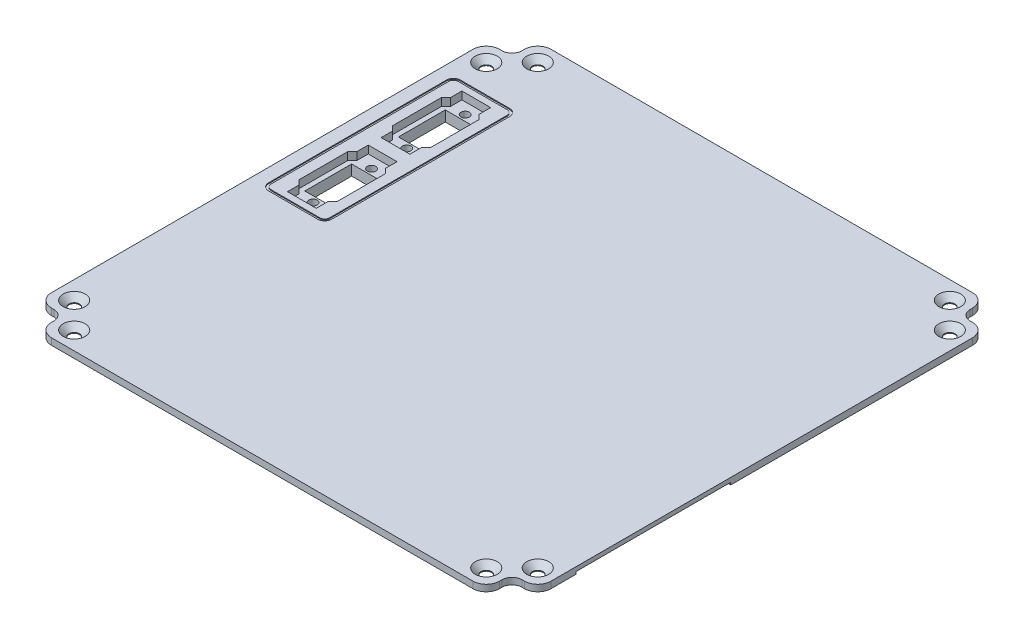
from build123d import *
from OCP.BRepFilletAPI import BRepFilletAPI_MakeChamfer, BRepFilletAPI_MakeFillet

# Parameters (mm, degrees)
SKETCH1_W                     = 214
SKETCH1_H                     = 214
BOSS_EXTRUDE1_DEPTH           = 2.8
SKETCH2_W                     = 11
SKETCH2_H                     = 11
CUT_EXTRUDE1_DEPTH            = 152.346754177
FILLET1_R1                    = 6
FILLET1_R2                    = 4
CIRPATTERN1_COUNT             = 4
FILLET1_OF_CIRPATTERN1_R1     = 6
FILLET1_OF_CIRPATTERN1_R2     = 4
FILLET1_OF_CIRPATTERN1_R3     = 6
FILLET1_OF_CIRPATTERN1_R4     = 4
FILLET1_OF_CIRPATTERN1_R5     = 6
FILLET1_OF_CIRPATTERN1_R6     = 4
CUT_EXTRUDE2_DEPTH            = 152.346754177
SKETCH7_R                     = 4.7
BOSS_EXTRUDE2_DEPTH           = 2.8
SKETCH8_W                     = 64.2
SKETCH8_H                     = 64.2
BOSS_EXTRUDE4_DEPTH           = 5
CHAMFER1_SIZE                 = 5
CHAMFER1_SIZE2                = 35
BOSS_EXTRUDE5_REACH           = 152.979
SKETCH10_W                    = 35
SKETCH10_H                    = 10.8
SKETCH10_H_2                  = 74.2
SKETCH10_H_3                  = 5
SKETCH9_W                     = 12
SKETCH9_H                     = 20
CUT_EXTRUDE3_DEPTH            = 3.3
SKETCH16_W                    = 12
SKETCH16_H                    = 20
CUT_EXTRUDE6_DEPTH            = 152.098047638
M3_CLEARANCE_HOLE1_AT_2_COUNT = 2
M3_CLEARANCE_HOLE1_AT_2_PITCH = 25
CUT_EXTRUDE_THIN1_DEPTH       = 0.4
LPATTERN1_COUNT               = 2
LPATTERN1_PITCH               = 40
SKETCH11_W                    = 4
SKETCH11_H                    = 143.4
SKETCH11_W_2                  = 143.4
SKETCH11_H_2                  = 4
SKETCH11_H_3                  = 10
CUT_EXTRUDE4_DEPTH            = 151.979402569
SKETCH12_W                    = 10.2
SKETCH12_H                    = 90
CUT_EXTRUDE5_DEPTH            = 151.979402569
CUT_EXTRUDE7_DEPTH            = 151.979402569
CUT_EXTRUDE7_DEPTH_BACK       = 1
SKETCH17_W                    = 35
SKETCH17_H                    = 66
CUT_EXTRUDE8_DEPTH            = 151.979402569
CUT_EXTRUDE8_DEPTH_BACK       = 1
SKETCH18_W                    = 35
SKETCH18_H                    = 66
SKETCH19_W                    = 8
SKETCH19_H                    = 91.967933368
SKETCH19_W_2                  = 153.383314932
SKETCH19_H_2                  = 8
SKETCH19_W_3                  = 152.504466573
CUT_EXTRUDE9_DEPTH            = 151.979402569


# Read off the part's stored shape, not the designer's step: CSK for M4 Flat Head Machine Screw1
with BuildPart() as part:
    # Sketch1 → Boss-Extrude1 (new body)
    with BuildSketch(Plane(origin=(0, 0, 0), x_dir=(1, 0, 0), z_dir=(0, 1, 0))):
        Rectangle(SKETCH1_W, SKETCH1_H)
    extrude(amount=BOSS_EXTRUDE1_DEPTH)

    # Sketch2 → Cut-Extrude1 (cut, through all)
    with BuildSketch(Plane(origin=(0, 2.8, 0), x_dir=(1, 0, 0), z_dir=(0, 1, 0))):
        with Locations((-101.5, -101.5)):
            Rectangle(SKETCH2_W, SKETCH2_H)
    cut_extrude1 = extrude(amount=-CUT_EXTRUDE1_DEPTH, mode=Mode.SUBTRACT)

    # Fillet1: one fillet with a radius per group of edges: ONE call of the kernel's fillet builder (fillet() takes one radius for all edges)
    fillet1_edges_1 = [part.edges().sort_by_distance(p)[0] for p in [
        (-107, 1.4, 96),
        (-96, 1.4, 107),
    ]]
    fillet1_edges_2 = [part.edges().sort_by_distance(p)[0] for p in [
        (-96, 1.4, 96),
    ]]
    fillet1 = BRepFilletAPI_MakeFillet(part.part.solid().wrapped)
    for e in fillet1_edges_1:
        fillet1.Add(FILLET1_R1, e.wrapped)
    for e in fillet1_edges_2:
        fillet1.Add(FILLET1_R2, e.wrapped)
    add(Compound.cast(fillet1.Shape()), mode=Mode.REPLACE)

    # CirPattern1: Cut-Extrude1 ×4 about axis
    cirpattern1_axis = Axis((0, 0, 0), (0, 1, 0))
    for i in range(1, CIRPATTERN1_COUNT):
        add(cut_extrude1.rotate(cirpattern1_axis, i * 360 / CIRPATTERN1_COUNT), mode=Mode.SUBTRACT)

    # Fillet1 of CirPattern1: one fillet with a radius per group of edges: ONE call of the kernel's fillet builder (fillet() takes one radius for all edges)
    fillet1_of_cirpattern1_edges_1 = [part.edges().sort_by_distance(p)[0] for p in [
        (96, 1.4, 107),
        (107, 1.4, 96),
    ]]
    fillet1_of_cirpattern1_edges_2 = [part.edges().sort_by_distance(p)[0] for p in [
        (96, 1.4, 96),
    ]]
    fillet1_of_cirpattern1_edges_3 = [part.edges().sort_by_distance(p)[0] for p in [
        (107, 1.4, -96),
        (96, 1.4, -107),
    ]]
    fillet1_of_cirpattern1_edges_4 = [part.edges().sort_by_distance(p)[0] for p in [
        (96, 1.4, -96),
    ]]
    fillet1_of_cirpattern1_edges_5 = [part.edges().sort_by_distance(p)[0] for p in [
        (-96, 1.4, -107),
        (-107, 1.4, -96),
    ]]
    fillet1_of_cirpattern1_edges_6 = [part.edges().sort_by_distance(p)[0] for p in [
        (-96, 1.4, -96),
    ]]
    fillet1_of_cirpattern1 = BRepFilletAPI_MakeFillet(part.part.solid().wrapped)
    for e in fillet1_of_cirpattern1_edges_1:
        fillet1_of_cirpattern1.Add(FILLET1_OF_CIRPATTERN1_R1, e.wrapped)
    for e in fillet1_of_cirpattern1_edges_2:
        fillet1_of_cirpattern1.Add(FILLET1_OF_CIRPATTERN1_R2, e.wrapped)
    for e in fillet1_of_cirpattern1_edges_3:
        fillet1_of_cirpattern1.Add(FILLET1_OF_CIRPATTERN1_R3, e.wrapped)
    for e in fillet1_of_cirpattern1_edges_4:
        fillet1_of_cirpattern1.Add(FILLET1_OF_CIRPATTERN1_R4, e.wrapped)
    for e in fillet1_of_cirpattern1_edges_5:
        fillet1_of_cirpattern1.Add(FILLET1_OF_CIRPATTERN1_R5, e.wrapped)
    for e in fillet1_of_cirpattern1_edges_6:
        fillet1_of_cirpattern1.Add(FILLET1_OF_CIRPATTERN1_R6, e.wrapped)
    add(Compound.cast(fillet1_of_cirpattern1.Shape()), mode=Mode.REPLACE)

    # Sketch3 → Cut-Extrude2 (cut, through all)
    with BuildSketch(Plane(origin=(0, 2.8, 0), x_dir=(1, 0, 0), z_dir=(0, 1, 0))):
        with BuildLine():
            Line((100, -96), (101, -96))
            ThreePointArc((101, -96), (105.242640687, -94.242640687), (107, -90))
            Line((107, -90), (107, 90))
            ThreePointArc((107, 90), (105.242640687, 94.242640687), (101, 96))
            Line((101, 96), (100, 96))
            ThreePointArc((100, 96), (97.171572875, 97.171572875), (96, 100))
            Line((96, 100), (96, 101))
            ThreePointArc((96, 101), (94.242640687, 105.242640687), (90, 107))
            Line((90, 107), (-90, 107))
            ThreePointArc((-90, 107), (-94.242640687, 105.242640687), (-96, 101))
            Line((-96, 101), (-96, 100))
            ThreePointArc((-96, 100), (-97.171572875, 97.171572875), (-100, 96))
            Line((-100, 96), (-101, 96))
            ThreePointArc((-101, 96), (-105.242640687, 94.242640687), (-107, 90))
            Line((-107, 90), (-107, -90))
            ThreePointArc((-107, -90), (-105.242640687, -94.242640687), (-101, -96))
            Line((-101, -96), (-100, -96))
            ThreePointArc((-100, -96), (-97.171572875, -97.171572875), (-96, -100))
            Line((-96, -100), (-96, -101))
            ThreePointArc((-96, -101), (-94.242640687, -105.242640687), (-90, -107))
            Line((-90, -107), (90, -107))
            ThreePointArc((90, -107), (94.242640687, -105.242640687), (96, -101))
            Line((96, -101), (96, -100))
            ThreePointArc((96, -100), (97.171572875, -97.171572875), (100, -96))
        make_face()
        with BuildLine():
            Line((100, -95.7), (101, -95.7))
            ThreePointArc((101, -95.7), (105.030508653, -94.030508653), (106.7, -90))
            Line((106.7, -90), (106.7, 90))
            ThreePointArc((106.7, 90), (105.030508653, 94.030508653), (101, 95.7))
            Line((101, 95.7), (100, 95.7))
            ThreePointArc((100, 95.7), (96.959440841, 96.959440841), (95.7, 100))
            Line((95.7, 100), (95.7, 101))
            ThreePointArc((95.7, 101), (94.030508653, 105.030508653), (90, 106.7))
            Line((90, 106.7), (-90, 106.7))
            ThreePointArc((-90, 106.7), (-94.030508653, 105.030508653), (-95.7, 101))
            Line((-95.7, 101), (-95.7, 100))
            ThreePointArc((-95.7, 100), (-96.959440841, 96.959440841), (-100, 95.7))
            Line((-100, 95.7), (-101, 95.7))
            ThreePointArc((-101, 95.7), (-105.030508653, 94.030508653), (-106.7, 90))
            Line((-106.7, 90), (-106.7, -90))
            ThreePointArc((-106.7, -90), (-105.030508653, -94.030508653), (-101, -95.7))
            Line((-101, -95.7), (-100, -95.7))
            ThreePointArc((-100, -95.7), (-96.959440841, -96.959440841), (-95.7, -100))
            Line((-95.7, -100), (-95.7, -101))
            ThreePointArc((-95.7, -101), (-94.030508653, -105.030508653), (-90, -106.7))
            Line((-90, -106.7), (90, -106.7))
            ThreePointArc((90, -106.7), (94.030508653, -105.030508653), (95.7, -101))
            Line((95.7, -101), (95.7, -100))
            ThreePointArc((95.7, -100), (96.959440841, -96.959440841), (100, -95.7))
        make_face(mode=Mode.SUBTRACT)
    extrude(amount=-CUT_EXTRUDE2_DEPTH, mode=Mode.SUBTRACT)

    # CSK for M4 Flat Head Machine Screw1 outl → CSK for M4 Flat Head Machine Screw1 (revolve, cut)
    with BuildSketch(Plane(origin=(-99, 0, 88), x_dir=(1, 0, 0), z_dir=(0, 0, 1))):
        Polygon((0, 0), (2.25, 0), (2.25, 0.35), (4.7, 2.8), (0, 2.8), align=None)
    revolve(axis=Axis((-99, 0, 88), (0, 1, 0)), mode=Mode.SUBTRACT)

    # CSK for M4 Flat Head Machine Screw1 2 ou → CSK for M4 Flat Head Machine Screw1 2 (revolve, cut)
    with BuildSketch(Plane(origin=(99, 0, -88), x_dir=(1, 0, 0), z_dir=(0, 0, 1))):
        Polygon((0, 0), (2.25, 0), (2.25, 0.35), (4.7, 2.8), (0, 2.8), align=None)
    revolve(axis=Axis((99, 0, -88), (0, 1, 0)), mode=Mode.SUBTRACT)

    # CSK for M4 Flat Head Machine Screw1 3 ou → CSK for M4 Flat Head Machine Screw1 3 (revolve, cut)
    with BuildSketch(Plane(origin=(99, 0, 88), x_dir=(1, 0, 0), z_dir=(0, 0, 1))):
        Polygon((0, 0), (2.25, 0), (2.25, 0.35), (4.7, 2.8), (0, 2.8), align=None)
    revolve(axis=Axis((99, 0, 88), (0, 1, 0)), mode=Mode.SUBTRACT)

    # CSK for M4 Flat Head Machine Screw1 4 ou → CSK for M4 Flat Head Machine Screw1 4 (revolve, cut)
    with BuildSketch(Plane(origin=(-99, 0, -88), x_dir=(1, 0, 0), z_dir=(0, 0, 1))):
        Polygon((0, 0), (2.25, 0), (2.25, 0.35), (4.7, 2.8), (0, 2.8), align=None)
    revolve(axis=Axis((-99, 0, -88), (0, 1, 0)), mode=Mode.SUBTRACT)

    # CSK for M4 Flat Head Machine Screw1 5 ou → CSK for M4 Flat Head Machine Screw1 5 (revolve, cut)
    with BuildSketch(Plane.XY):
        Polygon((0, 0), (2.25, 0), (2.25, 0.35), (4.7, 2.8), (0, 2.8), align=None)
    revolve(axis=Axis((0, 0, 0), (0, 1, 0)), mode=Mode.SUBTRACT)

    # CSK for M4 Flat Head Machine Screw1 6 ou → CSK for M4 Flat Head Machine Screw1 6 (revolve, cut)
    with BuildSketch(Plane(origin=(-88, 0, 99), x_dir=(1, 0, 0), z_dir=(0, 0, 1))):
        Polygon((0, 0), (2.25, 0), (2.25, 0.35), (4.7, 2.8), (0, 2.8), align=None)
    revolve(axis=Axis((-88, 0, 99), (0, 1, 0)), mode=Mode.SUBTRACT)

    # CSK for M4 Flat Head Machine Screw1 7 ou → CSK for M4 Flat Head Machine Screw1 7 (revolve, cut)
    with BuildSketch(Plane(origin=(88, 0, -99), x_dir=(1, 0, 0), z_dir=(0, 0, 1))):
        Polygon((0, 0), (2.25, 0), (2.25, 0.35), (4.7, 2.8), (0, 2.8), align=None)
    revolve(axis=Axis((88, 0, -99), (0, 1, 0)), mode=Mode.SUBTRACT)

    # CSK for M4 Flat Head Machine Screw1 8 ou → CSK for M4 Flat Head Machine Screw1 8 (revolve, cut)
    with BuildSketch(Plane(origin=(88, 0, 99), x_dir=(1, 0, 0), z_dir=(0, 0, 1))):
        Polygon((0, 0), (2.25, 0), (2.25, 0.35), (4.7, 2.8), (0, 2.8), align=None)
    revolve(axis=Axis((88, 0, 99), (0, 1, 0)), mode=Mode.SUBTRACT)

    # CSK for M4 Flat Head Machine Screw1 9 ou → CSK for M4 Flat Head Machine Screw1 9 (revolve, cut)
    with BuildSketch(Plane(origin=(-88, 0, -99), x_dir=(1, 0, 0), z_dir=(0, 0, 1))):
        Polygon((0, 0), (2.25, 0), (2.25, 0.35), (4.7, 2.8), (0, 2.8), align=None)
    revolve(axis=Axis((-88, 0, -99), (0, 1, 0)), mode=Mode.SUBTRACT)

    # Sketch7 → Boss-Extrude2 (add, through all)
    with BuildSketch(Plane(origin=(0, 2.8, 0), x_dir=(1, 0, 0), z_dir=(0, 1, 0))):
        Circle(SKETCH7_R)
    extrude(amount=-BOSS_EXTRUDE2_DEPTH)

    # Sketch8 → Boss-Extrude4 (add)
    with BuildSketch(Plane.XZ):
        Polygon((-2.5, 71.7), (-66.7, 71.7), (-66.7, 106.7), (-71.7, 106.7), (-71.7, 71.7), (-106.7, 71.7), (-106.7, 66.7), (-71.7, 66.7), (-71.7, 2.5), (-106.7, 2.5), (-106.7, -2.5), (-71.7, -2.5), (-71.7, -66.7), (-106.7, -66.7), (-106.7, -71.7), (-71.7, -71.7), (-71.7, -106.7), (-66.7, -106.7), (-66.7, -71.7), (-2.5, -71.7), (-2.5, -106.7), (2.5, -106.7), (2.5, -71.7), (66.7, -71.7), (66.7, -106.7), (71.7, -106.7), (71.7, -71.7), (106.7, -71.7), (106.7, -66.7), (71.7, -66.7), (71.7, -2.5), (106.7, -2.5), (106.7, 2.5), (71.7, 2.5), (71.7, 66.7), (106.7, 66.7), (106.7, 71.7), (71.7, 71.7), (71.7, 106.7), (66.7, 106.7), (66.7, 71.7), (2.5, 71.7), (2.5, 106.7), (-2.5, 106.7), align=None)
        with Locations((-34.6, -34.6)):
            Rectangle(SKETCH8_W, SKETCH8_H, mode=Mode.SUBTRACT)
        with Locations((34.6, -34.6)):
            Rectangle(SKETCH8_W, SKETCH8_H, mode=Mode.SUBTRACT)
        with Locations((-34.6, 34.6)):
            Rectangle(SKETCH8_W, SKETCH8_H, mode=Mode.SUBTRACT)
        with Locations((34.6, 34.6)):
            Rectangle(SKETCH8_W, SKETCH8_H, mode=Mode.SUBTRACT)
    extrude(amount=BOSS_EXTRUDE4_DEPTH)

    # Chamfer1: one chamfer whose edges measure the first distance from different faces: ONE call of the kernel's chamfer builder (chamfer() names one face for all edges)
    chamfer1_edges_1 = [part.edges().sort_by_distance(p)[0] for p in [
        (69.2, -5, 106.7),
        (0, -5, 106.7),
        (-69.2, -5, 106.7),
    ]]
    chamfer1_side_1 = [part.faces().sort_by_distance(p)[0] for p in [
        (0, 0.894818653, 106.7),
    ]]
    chamfer1_edges_2 = [part.edges().sort_by_distance(p)[0] for p in [
        (106.7, -5, 0),
        (106.7, -5, 69.2),
        (106.7, -5, -69.2),
    ]]
    chamfer1_side_2 = [part.faces().sort_by_distance(p)[0] for p in [
        (106.7, 0.894818653, 0),
    ]]
    chamfer1_edges_3 = [part.edges().sort_by_distance(p)[0] for p in [
        (69.2, -5, -106.7),
        (0, -5, -106.7),
        (-69.2, -5, -106.7),
    ]]
    chamfer1_side_3 = [part.faces().sort_by_distance(p)[0] for p in [
        (0, 0.894818653, -106.7),
    ]]
    chamfer1_edges_4 = [part.edges().sort_by_distance(p)[0] for p in [
        (-106.7, -5, 69.2),
        (-106.7, -5, 0),
        (-106.7, -5, -69.2),
    ]]
    chamfer1_side_4 = [part.faces().sort_by_distance(p)[0] for p in [
        (-106.7, 0.894818653, 0),
    ]]
    chamfer1 = BRepFilletAPI_MakeChamfer(part.part.solid().wrapped)
    for e in chamfer1_edges_1:
        chamfer1.Add(CHAMFER1_SIZE, CHAMFER1_SIZE2, e.wrapped, chamfer1_side_1[0].wrapped)  # the first distance lies on this face
    for e in chamfer1_edges_2:
        chamfer1.Add(CHAMFER1_SIZE, CHAMFER1_SIZE2, e.wrapped, chamfer1_side_2[0].wrapped)  # the first distance lies on this face
    for e in chamfer1_edges_3:
        chamfer1.Add(CHAMFER1_SIZE, CHAMFER1_SIZE2, e.wrapped, chamfer1_side_3[0].wrapped)  # the first distance lies on this face
    for e in chamfer1_edges_4:
        chamfer1.Add(CHAMFER1_SIZE, CHAMFER1_SIZE2, e.wrapped, chamfer1_side_4[0].wrapped)  # the first distance lies on this face
    add(Compound.cast(chamfer1.Shape()), mode=Mode.REPLACE)

    # Boss-Extrude5: up to this face of the body (flat: up to its plane)
    boss_extrude5_end = Plane(part.part.faces().sort_by_distance((0, -5, 0))[0])
    # Sketch10 → Boss-Extrude5 (add, up to the picked face)
    with BuildSketch(Plane.XZ, mode=Mode.PRIVATE) as boss_extrude5_sk1:
        with Locations((-89.2, 7.9)):
            Rectangle(SKETCH10_W, SKETCH10_H)
    boss_extrude5_tool1 = split(extrude(boss_extrude5_sk1.sketch, amount=BOSS_EXTRUDE5_REACH, mode=Mode.PRIVATE), bisect_by=boss_extrude5_end, keep=Keep.BOTH, mode=Mode.PRIVATE)
    # Sketch10 → Boss-Extrude5 (add, up to the picked face)
    with BuildSketch(Plane.XZ, mode=Mode.PRIVATE) as boss_extrude5_sk2:
        with Locations((-89.2, -34.6)):
            Rectangle(SKETCH10_W, SKETCH10_H_2)
    boss_extrude5_tool2 = split(extrude(boss_extrude5_sk2.sketch, amount=BOSS_EXTRUDE5_REACH, mode=Mode.PRIVATE), bisect_by=boss_extrude5_end, keep=Keep.BOTH, mode=Mode.PRIVATE)
    # Sketch10 → Boss-Extrude5 (add, up to the picked face)
    with BuildSketch(Plane.XZ, mode=Mode.PRIVATE) as boss_extrude5_sk3:
        with Locations((-89.2, -74.2)):
            Rectangle(SKETCH10_W, SKETCH10_H_3)
    boss_extrude5_tool3 = split(extrude(boss_extrude5_sk3.sketch, amount=BOSS_EXTRUDE5_REACH, mode=Mode.PRIVATE), bisect_by=boss_extrude5_end, keep=Keep.BOTH, mode=Mode.PRIVATE)
    add(boss_extrude5_tool1.solids().sort_by(Axis((-89.2, 0, 7.9), (0, -1, 0)))[0])
    add(boss_extrude5_tool2.solids().sort_by(Axis((-89.2, 0, -34.6), (0, -1, 0)))[0])
    add(boss_extrude5_tool3.solids().sort_by(Axis((-89.2, 0, -74.2), (0, -1, 0)))[0])

    # Sketch9 → Cut-Extrude3 (cut)
    with BuildSketch(Plane(origin=(0, 2.8, 0), x_dir=(1, 0, 0), z_dir=(0, 1, 0))):
        Polygon((-79.4, 44.6), (-79.4, 65.4), (-81.35, 67.35), (-81.35, 72.25), (-93.65, 72.25), (-93.65, 67.35), (-95.6, 65.4), (-95.6, 44.6), (-93.65, 42.65), (-93.65, 37.75), (-81.35, 37.75), (-81.35, 42.65), align=None)
        with Locations((-87.5, 55)):
            Rectangle(SKETCH9_W, SKETCH9_H, mode=Mode.SUBTRACT)
    cut_extrude3 = extrude(amount=-CUT_EXTRUDE3_DEPTH, mode=Mode.SUBTRACT)

    # Sketch16 → Cut-Extrude6 (cut, through all)
    with BuildSketch(Plane(origin=(0, 2.8, 0), x_dir=(1, 0, 0), z_dir=(0, 1, 0))):
        with Locations((-87.5, 55)):
            Rectangle(SKETCH16_W, SKETCH16_H)
    cut_extrude6 = extrude(amount=-CUT_EXTRUDE6_DEPTH, mode=Mode.SUBTRACT)

    # Sketch15 → M3 Clearance Hole1 (revolve, cut)
    with BuildSketch(Plane(origin=(-87.5, -0.5, -67.5), x_dir=(0, 0, 1), z_dir=(1, 0, 0))):
        Polygon((0, 0), (0, 7.081549114), (1.8, 6), (1.8, 0), align=None)
    m3_clearance_hole1 = revolve(axis=Axis((-87.5, 5.85, -67.5), (0, -1, 0)), mode=Mode.SUBTRACT)

    # M3 Clearance Hole1 at 2: M3 Clearance Hole1 ×2
    with Locations(*[(0, 0, i * M3_CLEARANCE_HOLE1_AT_2_PITCH) for i in range(1, M3_CLEARANCE_HOLE1_AT_2_COUNT)]):
        add(m3_clearance_hole1, mode=Mode.SUBTRACT)

    # Sketch9<3> → Cut-Extrude-Thin1 (cut)
    with BuildSketch(Plane(origin=(0, 2.8, 0), x_dir=(1, 0, 0), z_dir=(0, 1, 0))):
        with BuildLine():
            Line((-74, 73), (-74, -3))
            ThreePointArc((-74, -3), (-74.878679656, -5.121320344), (-77, -6))
            Line((-77, -6), (-98, -6))
            ThreePointArc((-98, -6), (-100.121320344, -5.121320344), (-101, -3))
            Line((-101, -3), (-101, 73))
            ThreePointArc((-101, 73), (-100.121320344, 75.121320344), (-98, 76))
            Line((-98, 76), (-77, 76))
            ThreePointArc((-77, 76), (-74.878679656, 75.121320344), (-74, 73))
        make_face()
        with BuildLine():
            Line((-75, 73), (-75, -3))
            ThreePointArc((-75, -3), (-75.585786438, -4.414213562), (-77, -5))
            Line((-77, -5), (-98, -5))
            ThreePointArc((-98, -5), (-99.414213562, -4.414213562), (-100, -3))
            Line((-100, -3), (-100, 73))
            ThreePointArc((-100, 73), (-99.414213562, 74.414213562), (-98, 75))
            Line((-98, 75), (-77, 75))
            ThreePointArc((-77, 75), (-75.585786438, 74.414213562), (-75, 73))
        make_face(mode=Mode.SUBTRACT)
    extrude(amount=-CUT_EXTRUDE_THIN1_DEPTH, mode=Mode.SUBTRACT)

    # LPattern1: Cut-Extrude3, Cut-Extrude6, M3 Clearance Hole1 ×2
    with Locations(*[(0, 0, i * LPATTERN1_PITCH) for i in range(1, LPATTERN1_COUNT)]):
        add(cut_extrude3, mode=Mode.SUBTRACT)
        add(cut_extrude6, mode=Mode.SUBTRACT)
        add(m3_clearance_hole1, mode=Mode.SUBTRACT)

    # LPattern1 copy 1 sketch → LPattern1 copy 1 (revolve, cut)
    with BuildSketch(Plane(origin=(-87.5, -0.5, -2.5), x_dir=(0, 0, 1), z_dir=(1, 0, 0))):
        Polygon((0, 0), (0, 7.081549114), (1.8, 6), (1.8, 0), align=None)
    revolve(axis=Axis((-87.5, 5.85, -2.5), (0, -1, 0)), mode=Mode.SUBTRACT)

    # Sketch11 → Cut-Extrude4 (cut, through all)
    with BuildSketch(Plane.XZ):
        with Locations((104.7, 0)):
            Rectangle(SKETCH11_W, SKETCH11_H)
        with Locations((0, -104.7)):
            Rectangle(SKETCH11_W_2, SKETCH11_H_2)
        with Locations((0, 104.7)):
            Rectangle(SKETCH11_W_2, SKETCH11_H_2)
        with Locations((-104.7, 66.7)):
            Rectangle(SKETCH11_W, SKETCH11_H_3)
    extrude(amount=CUT_EXTRUDE4_DEPTH, mode=Mode.SUBTRACT)

    # Sketch12 → Cut-Extrude5 (cut, through all)
    with BuildSketch(Plane.XZ):
        with Locations((-101.6, -31.7)):
            Rectangle(SKETCH12_W, SKETCH12_H)
    extrude(amount=CUT_EXTRUDE5_DEPTH, mode=Mode.SUBTRACT)

    # Sketch17 → Cut-Extrude7 (cut, two sides: drawn at the far end of the back side and taken through both)
    with BuildSketch(Plane.XZ.offset(-CUT_EXTRUDE7_DEPTH_BACK)):
        with Locations((-89.2, 46.3)):
            Rectangle(SKETCH17_W, SKETCH17_H)
    extrude(amount=CUT_EXTRUDE7_DEPTH + CUT_EXTRUDE7_DEPTH_BACK, mode=Mode.SUBTRACT)

    # Sketch18 → Cut-Extrude8 (cut, two sides: drawn at the far end of the back side and taken through both)
    with BuildSketch(Plane.XZ.offset(-CUT_EXTRUDE8_DEPTH_BACK)):
        with Locations((89.2, 46.3)):
            Rectangle(SKETCH18_W, SKETCH18_H)
        with Locations((-89.2, 46.3)):
            Rectangle(SKETCH18_W, SKETCH18_H)
    extrude(amount=CUT_EXTRUDE8_DEPTH + CUT_EXTRUDE8_DEPTH_BACK, mode=Mode.SUBTRACT)

    # Sketch19 → Cut-Extrude9 (cut, through all)
    with BuildSketch(Plane.XZ):
        with Locations((102.7, -32.683966684)):
            Rectangle(SKETCH19_W, SKETCH19_H)
        with Locations((0.281545553, -102.7)):
            Rectangle(SKETCH19_W_2, SKETCH19_H_2)
        with Locations((-0.157878627, 102.7)):
            Rectangle(SKETCH19_W_3, SKETCH19_H_2)
    extrude(amount=CUT_EXTRUDE9_DEPTH, mode=Mode.SUBTRACT)


solid = part.part
